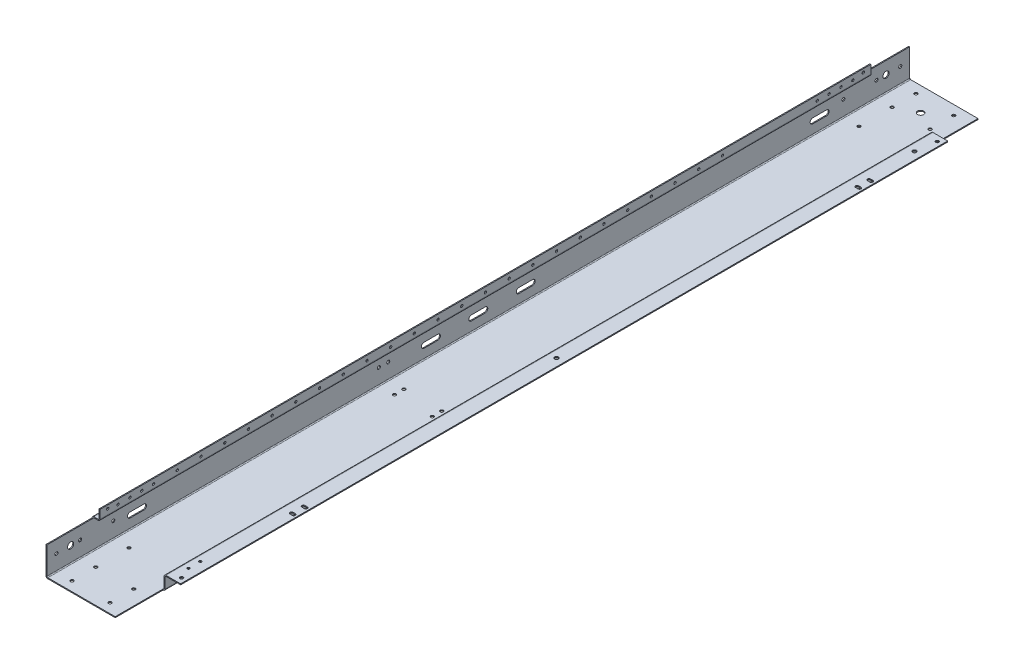
from build123d import *

# Parameters (mm, degrees)
SM_BASE_FLANGE_1_DEPTH = 910
SKETCH_6_W             = 101
SKETCH_6_H             = 30
CUT_EXTRUDE_1_DEPTH    = 37
SKETCH_7_W             = 17
SKETCH_7_H             = 97
CUT_EXTRUDE_2_DEPTH    = 24
SKETCH_8_R             = 6.5
SKETCH_8_R_2           = 3.25
CUT_EXTRUDE_3_DEPTH    = 10
SKETCH_9_R             = 3.25
CUT_EXTRUDE_4_DEPTH    = 10
CUT_EXTRUDE_7_DEPTH    = 10
CUT_EXTRUDE_8_DEPTH    = 10
SKETCH_16_R            = 3.25
SKETCH_16_R_2          = 6.5
CUT_EXTRUDE_9_DEPTH    = 10
SKETCH_17_R            = 2.5
CUT_EXTRUDE_10_DEPTH   = 10
SKETCH_25_R            = 4
SKETCH_25_R_2          = 2.5
CUT_EXTRUDE_16_DEPTH   = 10
SKETCH_26_R            = 3.25
CUT_EXTRUDE_17_DEPTH   = 10


# Sheet-metal steps are written as plain solids
with BuildPart() as part:
    # Sketch 1 → Базовая кромка1 (new, symmetric)
    with BuildSketch(Plane.XY):
        with BuildLine():
            Line((0, 0), (-31, 0))
            ThreePointArc((-31, 0), (-32.414213562, -0.585786438), (-33, -2))
            Line((-33, -2), (-33, -24))
            ThreePointArc((-33, -24), (-34.171572875, -26.828427125), (-37, -28))
            Line((-37, -28), (-179, -28))
            ThreePointArc((-179, -28), (-181.828427125, -26.828427125), (-183, -24))
            Line((-183, -24), (-183, 33))
            ThreePointArc((-183, 33), (-181.828427125, 35.828427125), (-179, 37))
            Line((-179, 37), (-170, 37))
            ThreePointArc((-170, 37), (-168.585786438, 37.585786438), (-168, 39))
            Line((-168, 39), (-168, 57))
            Line((-168, 57), (-166, 57))
            Line((-166, 57), (-166, 39))
            ThreePointArc((-166, 39), (-167.171572875, 36.171572875), (-170, 35))
            Line((-170, 35), (-179, 35))
            ThreePointArc((-179, 35), (-180.414213562, 34.414213562), (-181, 33))
            Line((-181, 33), (-181, -24))
            ThreePointArc((-181, -24), (-180.414213562, -25.414213562), (-179, -26))
            Line((-179, -26), (-37, -26))
            ThreePointArc((-37, -26), (-35.585786438, -25.414213562), (-35, -24))
            Line((-35, -24), (-35, -2))
            ThreePointArc((-35, -2), (-33.828427125, 0.828427125), (-31, 2))
            Line((-31, 2), (0, 2))
            Line((0, 2), (0, 0))
        make_face()
    extrude(amount=SM_BASE_FLANGE_1_DEPTH, both=True)

    # Эскиз6 → Cut-Extrude 1 (cut)
    with BuildSketch(Plane(origin=(0, 0, 0), x_dir=(0, 0, -1), z_dir=(1, 0, 0))):
        with Locations((-859.5, -13)):
            Rectangle(SKETCH_6_W, SKETCH_6_H)
        with Locations((859.5, -13)):
            Rectangle(SKETCH_6_W, SKETCH_6_H)
    extrude(amount=-CUT_EXTRUDE_1_DEPTH, mode=Mode.SUBTRACT)

    # Эскиз7 → Вырез-Вытянуть2 (cut)
    with BuildSketch(Plane(origin=(0, 57, 0), x_dir=(1, 0, 0), z_dir=(0, 1, 0))):
        with Locations((-174.5, -861.5)):
            Rectangle(SKETCH_7_W, SKETCH_7_H)
        with Locations((-174.5, 861.5)):
            Rectangle(SKETCH_7_W, SKETCH_7_H)
    extrude(amount=-CUT_EXTRUDE_2_DEPTH, mode=Mode.SUBTRACT)

    # Эскиз8 → Вырез-Вытянуть3 (cut)
    with BuildSketch(Plane(origin=(0, -26, 0), x_dir=(1, 0, 0), z_dir=(0, 1, 0))):
        with Locations(Location((-108, 860, 0), (0, 0, 180))):
            Circle(SKETCH_8_R)
        with Locations(Location((-68, 890, 0), (0, 0, 180))):
            Circle(SKETCH_8_R_2)
        with Locations(Location((-148, 890, 0), (0, 0, 180))):
            Circle(SKETCH_8_R_2)
        with Locations(Location((-148, 840, 0), (0, 0, 180))):
            Circle(SKETCH_8_R_2)
        with Locations(Location((-68, 840, 0), (0, 0, 180))):
            Circle(SKETCH_8_R_2)
        with Locations(Location((-148, 770, 0), (0, 0, 180))):
            Circle(SKETCH_8_R_2)
        with Locations((-148, -770)):
            Circle(SKETCH_8_R_2)
        with Locations((-148, -890)):
            Circle(SKETCH_8_R_2)
        with Locations((-148, -840)):
            Circle(SKETCH_8_R_2)
        with Locations((-68, -840)):
            Circle(SKETCH_8_R_2)
        with Locations((-68, -890)):
            Circle(SKETCH_8_R_2)
    extrude(amount=-CUT_EXTRUDE_3_DEPTH, mode=Mode.SUBTRACT)

    # Эскиз9 → Вырез-Вытянуть4 (cut)
    with BuildSketch(Plane(origin=(0, -26, 0), x_dir=(1, 0, 0), z_dir=(0, 1, 0))):
        with Locations(Location((-68, -190, 0), (0, 0, 180))):
            Circle(SKETCH_9_R)
        with Locations(Location((-148, -190, 0), (0, 0, 180))):
            Circle(SKETCH_9_R)
        with Locations(Location((-148, -210, 0), (0, 0, 180))):
            Circle(SKETCH_9_R)
        with Locations(Location((-68, -210, 0), (0, 0, 180))):
            Circle(SKETCH_9_R)
    cut_extrude_4 = extrude(amount=-CUT_EXTRUDE_4_DEPTH, mode=Mode.SUBTRACT)

    # Зеркальное отражение1: Вырез-Вытянуть4 across plane
    add(cut_extrude_4.mirror(Plane(origin=(-77.5, 77.5, 0), x_dir=(0, 0, 1), z_dir=(-0.7071067811865476, 0.7071067811865475, 0))), mode=Mode.SUBTRACT)

    # Эскиз14 → Вырез-Вытянуть7 (cut)
    with BuildSketch(Plane.XZ):
        with BuildLine():
            Line((-12, 566.25), (-7, 566.25))
            ThreePointArc((-7, 566.25), (-3.75, 563), (-7, 559.75))
            Line((-7, 559.75), (-12, 559.75))
            ThreePointArc((-12, 559.75), (-15.25, 563), (-12, 566.25))
        make_face()
        with BuildLine():
            Line((-12, 541.25), (-7, 541.25))
            ThreePointArc((-7, 541.25), (-3.75, 538), (-7, 534.75))
            Line((-7, 534.75), (-12, 534.75))
            ThreePointArc((-12, 534.75), (-15.25, 538), (-12, 541.25))
        make_face()
        with BuildLine():
            Line((-12, -626.75), (-7, -626.75))
            ThreePointArc((-7, -626.75), (-3.75, -630), (-7, -633.25))
            Line((-7, -633.25), (-12, -633.25))
            ThreePointArc((-12, -633.25), (-15.25, -630), (-12, -626.75))
        make_face()
        with BuildLine():
            Line((-12, -651.75), (-7, -651.75))
            ThreePointArc((-7, -651.75), (-3.75, -655), (-7, -658.25))
            Line((-7, -658.25), (-12, -658.25))
            ThreePointArc((-12, -658.25), (-15.25, -655), (-12, -651.75))
        make_face()
    extrude(amount=-CUT_EXTRUDE_7_DEPTH, mode=Mode.SUBTRACT)

    # Эскиз15 → Вырез-Вытянуть8 (cut)
    with BuildSketch(Plane.ZY.offset(183)):
        with BuildLine():
            Line((-734.5, 5.5), (-705.5, 5.5))
            ThreePointArc((-705.5, 5.5), (-700, 0), (-705.5, -5.5))
            Line((-705.5, -5.5), (-734.5, -5.5))
            ThreePointArc((-734.5, -5.5), (-740, 0), (-734.5, 5.5))
        make_face()
        with BuildLine():
            Line((-85.5, -5.5), (-114.5, -5.5))
            ThreePointArc((-114.5, -5.5), (-120, 0), (-114.5, 5.5))
            Line((-114.5, 5.5), (-85.5, 5.5))
            ThreePointArc((-85.5, 5.5), (-80, 0), (-85.5, -5.5))
        make_face()
        with BuildLine():
            Line((14.5, -5.5), (-14.5, -5.5))
            ThreePointArc((-14.5, -5.5), (-20, 0), (-14.5, 5.5))
            Line((-14.5, 5.5), (14.5, 5.5))
            ThreePointArc((14.5, 5.5), (20, 0), (14.5, -5.5))
        make_face()
        with BuildLine():
            Line((114.5, -5.5), (85.5, -5.5))
            ThreePointArc((85.5, -5.5), (80, 0), (85.5, 5.5))
            Line((85.5, 5.5), (114.5, 5.5))
            ThreePointArc((114.5, 5.5), (120, 0), (114.5, -5.5))
        make_face()
        with BuildLine():
            Line((734.5, -5.5), (705.5, -5.5))
            ThreePointArc((705.5, -5.5), (700, 0), (705.5, 5.5))
            Line((705.5, 5.5), (734.5, 5.5))
            ThreePointArc((734.5, 5.5), (740, 0), (734.5, -5.5))
        make_face()
    extrude(amount=-CUT_EXTRUDE_8_DEPTH, mode=Mode.SUBTRACT)

    # Эскиз16 → Вырез-Вытянуть9 (cut)
    with BuildSketch(Plane.ZY.offset(183)):
        with Locations((890, 7)):
            Circle(SKETCH_16_R)
        with Locations((860, 7)):
            Circle(SKETCH_16_R_2)
        with Locations((840, 7)):
            Circle(SKETCH_16_R)
        with Locations((770, 7)):
            Circle(SKETCH_16_R)
        with Locations(Location((-770, 7, 0), (0, 0, 180))):
            Circle(SKETCH_16_R)
        with Locations(Location((-840, 7, 0), (0, 0, 180))):
            Circle(SKETCH_16_R)
        with Locations(Location((-860, 7, 0), (0, 0, 180))):
            Circle(SKETCH_16_R_2)
        with Locations(Location((-890, 7, 0), (0, 0, 180))):
            Circle(SKETCH_16_R)
    extrude(amount=-CUT_EXTRUDE_9_DEPTH, mode=Mode.SUBTRACT)

    # Эскиз17 → Вырез-Вытянуть10 (cut)
    with BuildSketch(Plane.ZY.offset(168)):
        with Locations((775, 47)):
            Circle(SKETCH_17_R)
        with Locations((-500, 47)):
            Circle(SKETCH_17_R)
        with Locations((-775, 47)):
            Circle(SKETCH_17_R)
        with Locations((-797, 50)):
            Circle(SKETCH_17_R)
        with Locations((797, 50)):
            Circle(SKETCH_17_R)
        with Locations((-750, 47)):
            Circle(SKETCH_17_R)
        with Locations((-725, 47)):
            Circle(SKETCH_17_R)
        with Locations((-700, 47)):
            Circle(SKETCH_17_R)
        with Locations((-450, 47)):
            Circle(SKETCH_17_R)
        with Locations((-400, 47)):
            Circle(SKETCH_17_R)
        with Locations((-350, 47)):
            Circle(SKETCH_17_R)
        with Locations((-300, 47)):
            Circle(SKETCH_17_R)
        with Locations((-250, 47)):
            Circle(SKETCH_17_R)
        with Locations((-200, 47)):
            Circle(SKETCH_17_R)
        with Locations((-150, 47)):
            Circle(SKETCH_17_R)
        with Locations((-100, 47)):
            Circle(SKETCH_17_R)
        with Locations((-50, 47)):
            Circle(SKETCH_17_R)
        with Locations((0, 47)):
            Circle(SKETCH_17_R)
        with Locations((50, 47)):
            Circle(SKETCH_17_R)
        with Locations((100, 47)):
            Circle(SKETCH_17_R)
        with Locations((150, 47)):
            Circle(SKETCH_17_R)
        with Locations((200, 47)):
            Circle(SKETCH_17_R)
        with Locations((250, 47)):
            Circle(SKETCH_17_R)
        with Locations((300, 47)):
            Circle(SKETCH_17_R)
        with Locations((350, 47)):
            Circle(SKETCH_17_R)
        with Locations((750, 47)):
            Circle(SKETCH_17_R)
        with Locations((725, 47)):
            Circle(SKETCH_17_R)
        with Locations((700, 47)):
            Circle(SKETCH_17_R)
        with Locations((400, 47)):
            Circle(SKETCH_17_R)
        with Locations((450, 47)):
            Circle(SKETCH_17_R)
        with Locations((500, 47)):
            Circle(SKETCH_17_R)
        with Locations((550, 47)):
            Circle(SKETCH_17_R)
        with Locations((600, 47)):
            Circle(SKETCH_17_R)
        with Locations((650, 47)):
            Circle(SKETCH_17_R)
    extrude(amount=-CUT_EXTRUDE_10_DEPTH, mode=Mode.SUBTRACT)

    # Эскиз25 → Вырез-Вытянуть16 (cut)
    with BuildSketch(Plane.XZ):
        with Locations(Location((-16, -755, 0), (0, 0, 270))):
            Circle(SKETCH_25_R)
        with Locations(Location((-16, 0, 0), (0, 0, 270))):
            Circle(SKETCH_25_R)
        with Locations(Location((-20, 772.5, 0), (0, 0, 270))):
            Circle(SKETCH_25_R_2)
        with Locations(Location((-20, 747.5, 0), (0, 0, 270))):
            Circle(SKETCH_25_R_2)
    extrude(amount=-CUT_EXTRUDE_16_DEPTH, mode=Mode.SUBTRACT)

    # Эскиз26 → Вырез-Вытянуть17 (cut)
    with BuildSketch(Plane.XZ):
        with Locations(Location((-10, -797, 0), (0, 0, 270))):
            Circle(SKETCH_26_R)
        with Locations(Location((-10, 797, 0), (0, 0, 270))):
            Circle(SKETCH_26_R)
    extrude(amount=-CUT_EXTRUDE_17_DEPTH, mode=Mode.SUBTRACT)


solid = part.part
